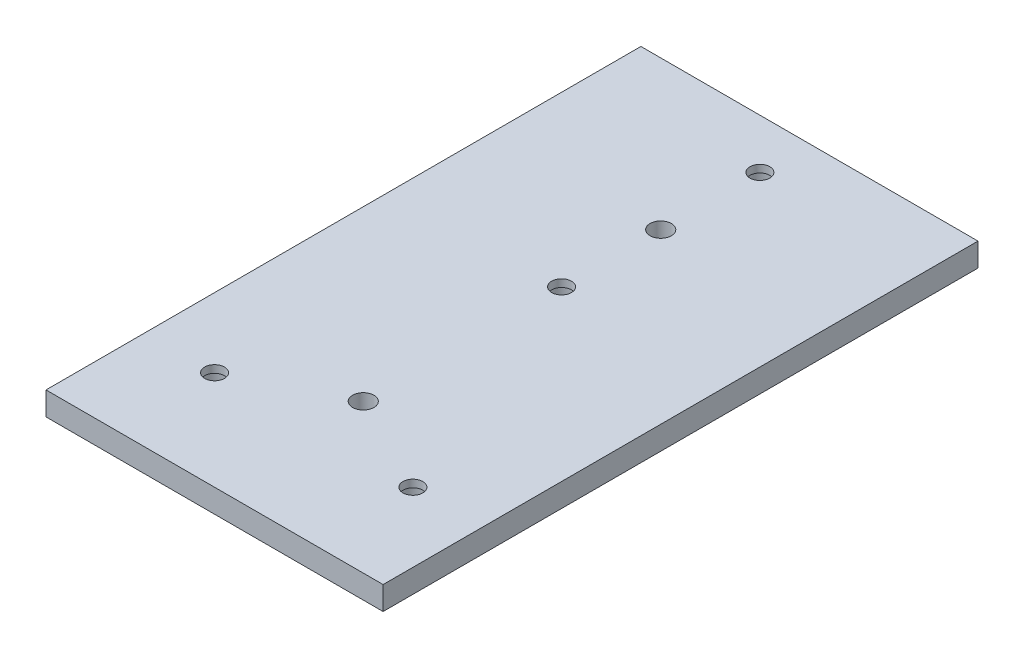
from build123d import *

# Parameters (mm, degrees)
SKETCH2_W               = 88.9
SKETCH2_H               = 152.4
BOSS_EXTRUDE1_DEPTH     = 5.9944
CUT_EXTRUDE2_DEPTH      = 177.535840076
CUT_EXTRUDE2_DEPTH_BACK = 177.535840076
SKETCH4_R               = 2.7305
CUT_EXTRUDE3_DEPTH      = 177.535840076
CUT_EXTRUDE3_DEPTH_BACK = 177.535840076
SKETCH7_W               = 2.54
SKETCH7_H               = 152.4
CUT_EXTRUDE4_DEPTH      = 177.535840076
CUT_EXTRUDE4_DEPTH_BACK = 177.535840076
SKETCH8_R               = 2.54
SKETCH9_R               = 3.683
CUT_EXTRUDE5_DEPTH      = 4.064


with BuildPart() as part:
    # Sketch2 → Boss-Extrude1 (new body)
    with BuildSketch(Plane(origin=(0, 0, 0), x_dir=(1, 0, 0), z_dir=(0, 1, 0))):
        with Locations((44.45, 76.2)):
            Rectangle(SKETCH2_W, SKETCH2_H)
    extrude(amount=BOSS_EXTRUDE1_DEPTH)

    # Sketch4 → Cut-Extrude2 (cut, two sides: drawn at the far end of the back side and taken through both)
    with BuildSketch(Plane(origin=(0, 5.9944, 0), x_dir=(1, 0, 0), z_dir=(0, 1, 0)).offset(-CUT_EXTRUDE2_DEPTH_BACK)):
        with Locations((45.72, 114.3)):
            Circle(SKETCH4_R)
        with Locations((45.72, 38.1)):
            Circle(SKETCH4_R)
    extrude(amount=CUT_EXTRUDE2_DEPTH + CUT_EXTRUDE2_DEPTH_BACK, mode=Mode.SUBTRACT)

    # Sketch7 → Cut-Extrude3 (cut, two sides: drawn at the far end of the back side and taken through both)
    with BuildSketch(Plane(origin=(0, 5.9944, 0), x_dir=(1, 0, 0), z_dir=(0, 1, 0)).offset(-CUT_EXTRUDE3_DEPTH_BACK)):
        with Locations((1.27, 76.2)):
            Rectangle(SKETCH7_W, SKETCH7_H)
    extrude(amount=CUT_EXTRUDE3_DEPTH + CUT_EXTRUDE3_DEPTH_BACK, mode=Mode.SUBTRACT)

    # Sketch8 → Cut-Extrude4 (cut, two sides: drawn at the far end of the back side and taken through both)
    with BuildSketch(Plane(origin=(0, 5.9944, 0), x_dir=(1, 0, 0), z_dir=(0, 1, 0)).offset(-CUT_EXTRUDE4_DEPTH_BACK)):
        with Locations((20.32, 25.4)):
            Circle(SKETCH8_R)
        with Locations((71.12, 25.4)):
            Circle(SKETCH8_R)
        with Locations((45.72, 88.9)):
            Circle(SKETCH8_R)
        with Locations((45.72, 139.7)):
            Circle(SKETCH8_R)
    extrude(amount=CUT_EXTRUDE4_DEPTH + CUT_EXTRUDE4_DEPTH_BACK, mode=Mode.SUBTRACT)

    # Sketch9 → Cut-Extrude5 (cut)
    with BuildSketch(Plane.XZ):
        with Locations((20.32, -25.4)):
            Circle(SKETCH9_R)
        with Locations((71.12, -25.4)):
            Circle(SKETCH9_R)
        with Locations((45.72, -88.9)):
            Circle(SKETCH9_R)
        with Locations((45.72, -139.7)):
            Circle(SKETCH9_R)
    extrude(amount=-CUT_EXTRUDE5_DEPTH, mode=Mode.SUBTRACT)


solid = part.part
